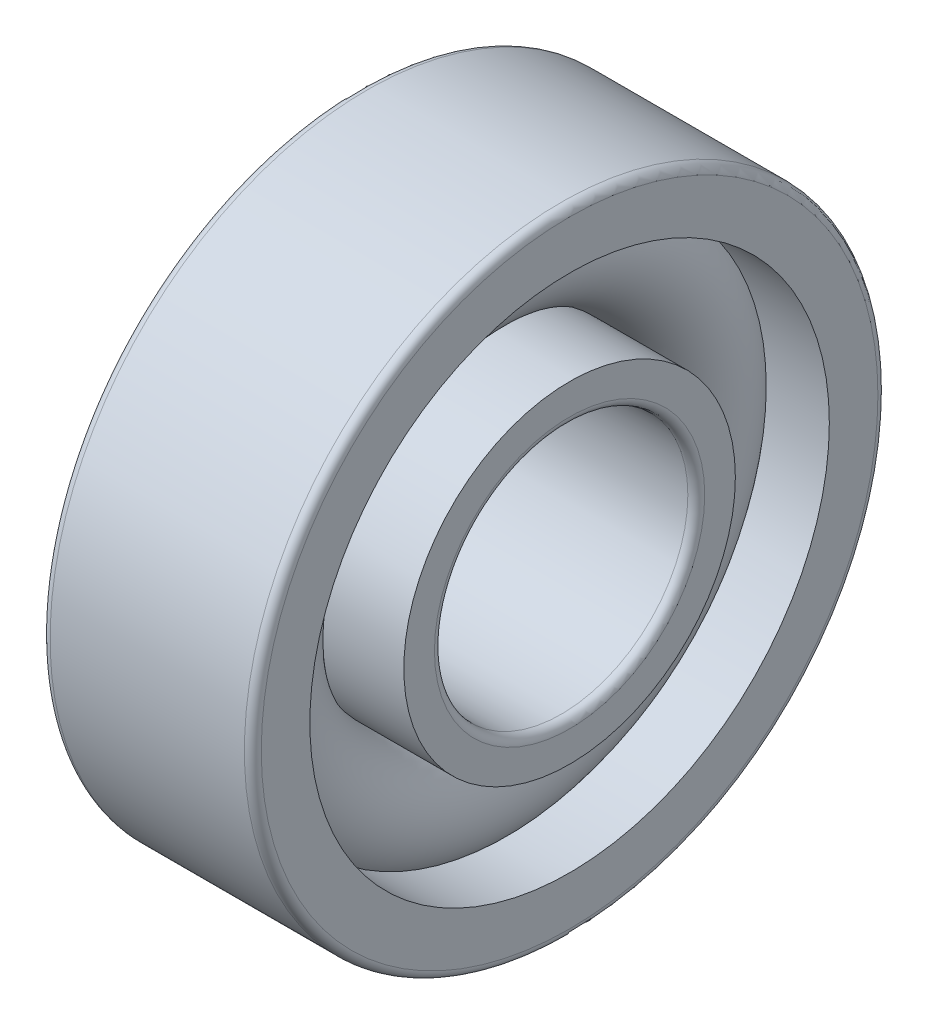
from build123d import *

# Parameters (mm, degrees)
CAGSPISKE_W     = 0.675
CAGSPISKE_H     = 0.45
CAGESPINE_ANGLE = 0.001
BALSIMSKE_R     = 1.35


with BuildPart() as part:
    # CagSpiSke → CageSpine (revolve)
    with BuildSketch(Plane.XY):
        with Locations((0, 5.25)):
            Rectangle(CAGSPISKE_W, CAGSPISKE_H)
    revolve(axis=Axis((-20.6375, 0, 0), (1, 0, 0)), revolution_arc=CAGESPINE_ANGLE)

    # BalSimSke → BallsSimplified (revolve)
    with BuildSketch(Plane.XY):
        with Locations((0, 5.25)):
            Circle(BALSIMSKE_R)
    revolve(axis=Axis((-10, 0, 0), (1, 0, 0)))

    # InnRacSke → InnerRace (revolve)
    with BuildSketch(Plane.XY):
        with BuildLine():
            Line((-0.972432517, 4.35), (-2.5, 4.35))
            Line((-2.5, 4.35), (-2.5, 3.2))
            ThreePointArc((-2.5, 3.2), (-2.441421356, 3.058578644), (-2.3, 3))
            Line((-2.3, 3), (2.3, 3))
            ThreePointArc((2.3, 3), (2.441421356, 3.058578644), (2.5, 3.2))
            Line((2.5, 3.2), (2.5, 3.925))
            Line((2.5, 3.925), (0, 3.925))
            ThreePointArc((0, 3.925), (-0.530624632, 4.035890244), (-0.972432517, 4.35))
        make_face()
    revolve(axis=Axis((-20.6375, 0, 0), (1, 0, 0)))

    # OutRacSke → OuterRace (revolve)
    with BuildSketch(Plane.XY):
        with BuildLine():
            Line((0, 6.575), (-2.5, 6.575))
            Line((-2.5, 6.575), (-2.5, 7.3))
            ThreePointArc((-2.5, 7.3), (-2.441421356, 7.441421356), (-2.3, 7.5))
            Line((-2.3, 7.5), (2.3, 7.5))
            ThreePointArc((2.3, 7.5), (2.441421356, 7.441421356), (2.5, 7.3))
            Line((2.5, 7.3), (2.5, 6.15))
            Line((2.5, 6.15), (0.972432517, 6.15))
            ThreePointArc((0.972432517, 6.15), (0.530624632, 6.464109756), (0, 6.575))
        make_face()
    revolve(axis=Axis((-20.6375, 0, 0), (1, 0, 0)))


solid = part.part
